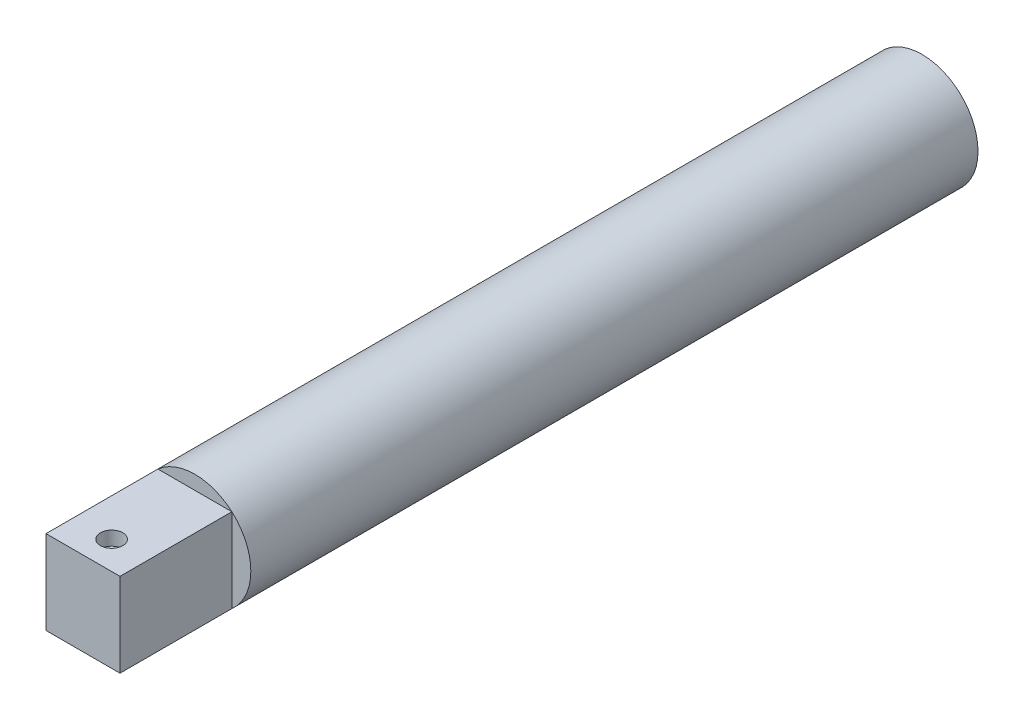
from build123d import *

# Parameters (mm, degrees)
SKETCH1_R           = 10
BOSS_EXTRUDE1_DEPTH = 150
CUT_EXTRUDE1_START  = -20
CUT_EXTRUDE1_DEPTH  = 20
SKETCH3_R           = 2
SKETCH3_R_2         = 1
CUT_EXTRUDE2_DEPTH  = 2.5
SKETCH3_3_R         = 1
CUT_EXTRUDE4_DEPTH  = 152.348108677
SKETCH7_R           = 1
CUT_EXTRUDE5_DEPTH  = 10


with BuildPart() as part:
    # Sketch1 → Boss-Extrude1 (new body)
    with BuildSketch(Plane.XY):
        Circle(SKETCH1_R)
    extrude(amount=BOSS_EXTRUDE1_DEPTH)

    # Sketch2 → Cut-Extrude1 (cut)
    with BuildSketch(Plane.XY.offset(150).offset(CUT_EXTRUDE1_START)):
        with BuildLine():
            ThreePointArc((6.614378278, 7.5), (0, 10), (-6.614378278, 7.5))
            Line((-6.614378278, 7.5), (6.614378278, 7.5))
        make_face()
        with BuildLine():
            Line((-6.614378278, -7.5), (-6.614378278, 7.5))
            ThreePointArc((-6.614378278, 7.5), (-10, 0), (-6.614378278, -7.5))
        make_face()
        with BuildLine():
            ThreePointArc((6.614378278, -7.5), (10, 0), (6.614378278, 7.5))
            Line((6.614378278, 7.5), (6.614378278, -7.5))
        make_face()
        with BuildLine():
            Line((6.614378278, -7.5), (-6.614378278, -7.5))
            ThreePointArc((-6.614378278, -7.5), (0, -10), (6.614378278, -7.5))
        make_face()
    extrude(amount=CUT_EXTRUDE1_DEPTH, mode=Mode.SUBTRACT)

    # Sketch3 → Cut-Extrude2 (cut)
    with BuildSketch(Plane(origin=(0, 7.5, 0), x_dir=(1, 0, 0), z_dir=(0, 1, 0))):
        with Locations((0.114378278, -145)):
            Circle(SKETCH3_R)
        with Locations((0.114378278, -145)):
            Circle(SKETCH3_R_2, mode=Mode.SUBTRACT)
    extrude(amount=-CUT_EXTRUDE2_DEPTH, mode=Mode.SUBTRACT)

    # Sketch3<3> → Cut-Extrude4 (cut, through all)
    with BuildSketch(Plane(origin=(0, 7.5, 0), x_dir=(1, 0, 0), z_dir=(0, 1, 0))):
        with Locations((0.114378278, -145)):
            Circle(SKETCH3_3_R)
    extrude(amount=-CUT_EXTRUDE4_DEPTH, mode=Mode.SUBTRACT)

    # Sketch7 → Cut-Extrude5 (cut)
    with BuildSketch(Plane(origin=(0, 0, 0), x_dir=(-1, 0, 0), z_dir=(0, 0, -1))):
        with Locations((5, 0)):
            Circle(SKETCH7_R)
        with Locations((-5, 0)):
            Circle(SKETCH7_R)
    extrude(amount=-CUT_EXTRUDE5_DEPTH, mode=Mode.SUBTRACT)


solid = part.part
